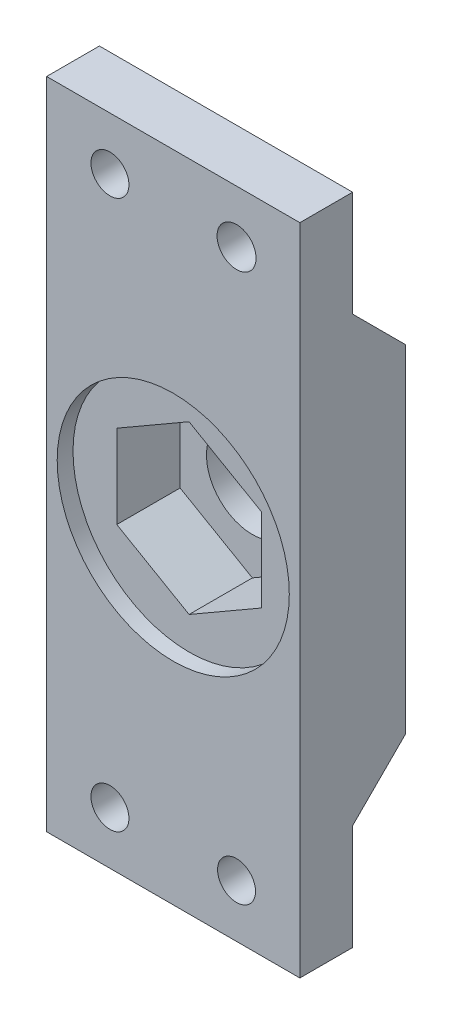
from build123d import *

# Parameters (mm, degrees)
ESBO_O1_W                = 24
ESBO_O1_H                = 62
RESSALTO_EXTRUS_O1_DEPTH = 10
ESBO_O4_R                = 11
CORTE_EXTRUS_O1_DEPTH    = 1.5
CORTE_EXTRUS_O2_DEPTH    = 6
ESBO_O9_R                = 4.35
ESBO_O9_R_2              = 1.85
ESBO_O9_R_3              = 1.8
CORTE_EXTRUS_O4_DEPTH    = 35.713109915
ESBO_O11_OUTSIDE_W       = 25.446
ESBO_O11_OUTSIDE_H       = 77.446
CORTE_EXTRUS_O7_DEPTH    = 41.459856648


with BuildPart() as part:
    # Esboço1 → Ressalto-extrusão1 (new body)
    with BuildSketch(Plane.XY):
        Rectangle(ESBO_O1_W, ESBO_O1_H)
    extrude(amount=RESSALTO_EXTRUS_O1_DEPTH)

    # Esboço4 → Corte-extrusão1 (cut)
    with BuildSketch(Plane(origin=(0, 0, 10), x_dir=(-1, 0, 0), z_dir=(0, 0, -1))):
        Circle(ESBO_O4_R)
    extrude(amount=CORTE_EXTRUS_O1_DEPTH, mode=Mode.SUBTRACT)

    # Esboço6 → Corte-extrusão2 (cut)
    with BuildSketch(Plane.XY.offset(8.5)):
        Polygon((0, -7.909698688), (6.85, -3.954849344), (6.85, 3.954849344), (0, 7.909698688), (-6.85, 3.954849344), (-6.85, -3.954849344), align=None)
    extrude(amount=-CORTE_EXTRUS_O2_DEPTH, mode=Mode.SUBTRACT)

    # Esboço9 → Corte-extrusão4 (cut, through all)
    with BuildSketch(Plane.XY.offset(10)):
        Circle(ESBO_O9_R)
        with Locations((6, 26)):
            Circle(ESBO_O9_R_2)
        with Locations((-6, 26)):
            Circle(ESBO_O9_R_3)
        with Locations((-6, -26)):
            Circle(ESBO_O9_R_3)
        with Locations((6, -26)):
            Circle(ESBO_O9_R_3)
    extrude(amount=-CORTE_EXTRUS_O4_DEPTH, mode=Mode.SUBTRACT)

    # Esboço11 outside → Corte-extrusão7 (cut, through all)
    with BuildSketch(Plane.ZY.offset(12)):
        with Locations((5, 0)):
            Rectangle(ESBO_O11_OUTSIDE_W, ESBO_O11_OUTSIDE_H)
        Polygon((5.004562024, -21), (5, -31), (10, -31), (10, 31), (5, 31), (5.004562024, 21), (0, 15.995437976), (0, -15.995437976), align=None, mode=Mode.SUBTRACT)
    extrude(amount=-CORTE_EXTRUS_O7_DEPTH, mode=Mode.SUBTRACT)


solid = part.part
